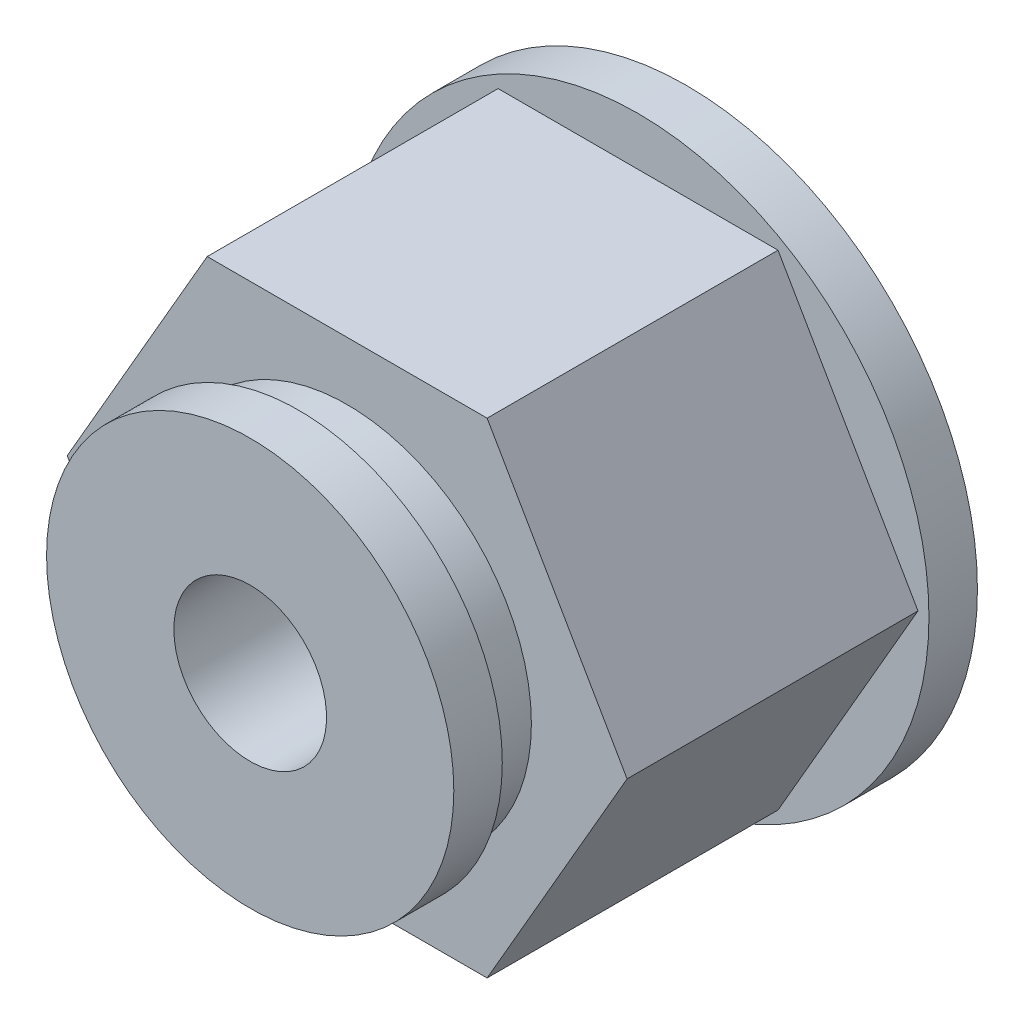
from build123d import *

# Parameters (mm, degrees)
BOSS_EXTRU_1_DEPTH      = 3.81
ESQUISSE2_R             = 7.62
BOSS_EXTRU_2_DEPTH      = 1.27
ESQUISSE3_R             = 4.826
BOSS_EXTRU_3_DEPTH      = 1.27
ESQUISSE4_R             = 5.334
BOSS_EXTRU_4_DEPTH      = 1.27
ESQUISSE5_R             = 2
ENL_V_MAT_EXTRU_1_DEPTH = 16.709032434


with BuildPart() as part:
    # Esquisse1 → Boss.-Extru.1 (new, symmetric)
    with BuildSketch(Plane.XY):
        Polygon((7.332348419, 0), (3.666174209, 6.35), (-3.666174209, 6.35), (-7.332348419, 0), (-3.666174209, -6.35), (3.666174209, -6.35), align=None)
    extrude(amount=BOSS_EXTRU_1_DEPTH, both=True)

    # Esquisse2 → Boss.-Extru.2 (add)
    with BuildSketch(Plane(origin=(0, 0, -3.81), x_dir=(-1, 0, 0), z_dir=(0, 0, -1))):
        Circle(ESQUISSE2_R)
    extrude(amount=BOSS_EXTRU_2_DEPTH)

    # Esquisse3 → Boss.-Extru.3 (add)
    with BuildSketch(Plane.XY.offset(3.81)):
        Circle(ESQUISSE3_R)
    extrude(amount=BOSS_EXTRU_3_DEPTH)

    # Esquisse4 → Boss.-Extru.4 (add)
    with BuildSketch(Plane.XY.offset(5.08)):
        Circle(ESQUISSE4_R)
    extrude(amount=BOSS_EXTRU_4_DEPTH)

    # Esquisse5 → Enlèv. mat.-Extru.1 (cut, through all)
    with BuildSketch(Plane(origin=(0, 0, -5.08), x_dir=(-1, 0, 0), z_dir=(0, 0, -1))):
        Circle(ESQUISSE5_R)
    extrude(amount=-ENL_V_MAT_EXTRU_1_DEPTH, mode=Mode.SUBTRACT)


solid = part.part
